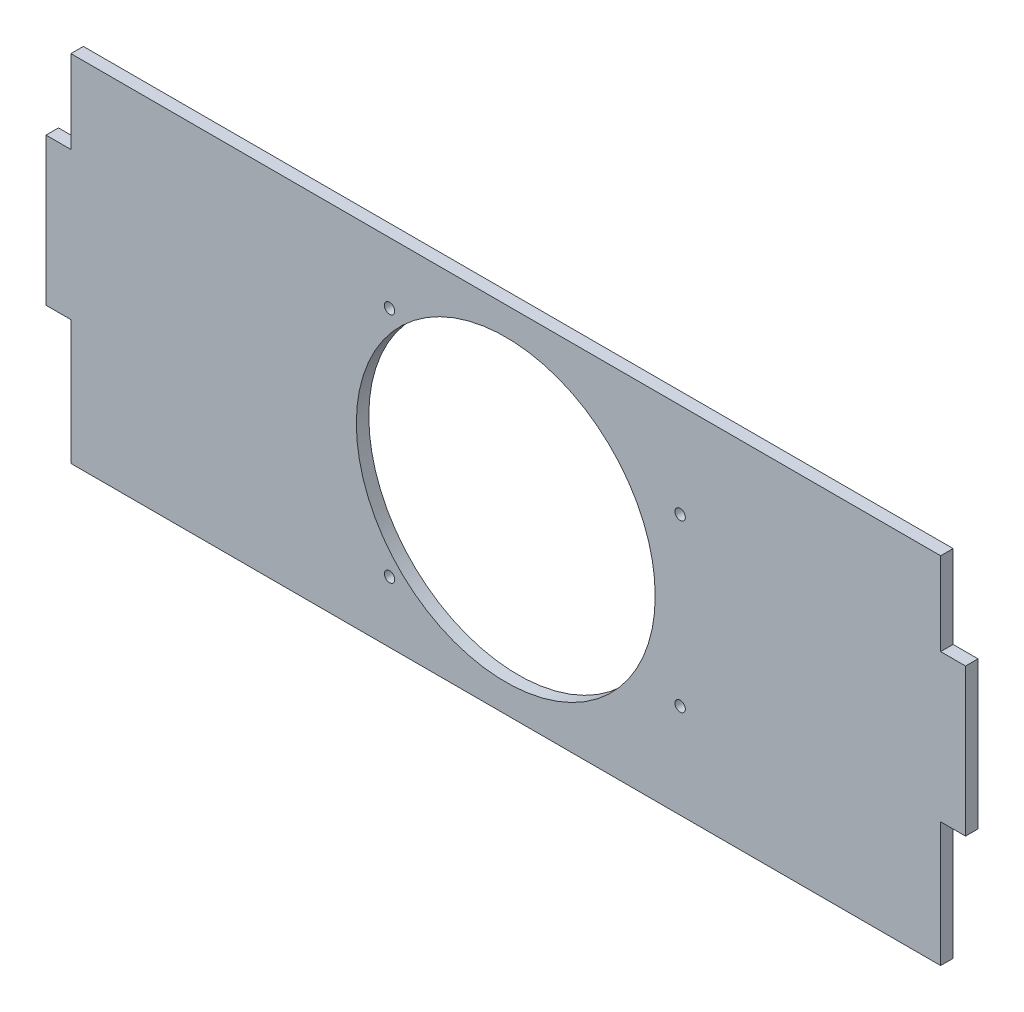
from build123d import *

# Parameters (mm, degrees)
BOSS_EXTRUDE1_DEPTH = 3
SKETCH2_R           = 36
CUT_EXTRUDE1_DEPTH  = 229.367029144
CAVITY1_OUTLINE_R   = 1.25
CAVITY1_DEPTH       = 3


# Read off the part's stored shape, not the designer's step: Cavity1
with BuildPart() as part:
    # Sketch1 → Boss-Extrude1 (new body)
    with BuildSketch(Plane.XY):
        Polygon((6, -30), (215.5, -30), (215.5, 0), (221.5, 0), (221.5, 35.5), (215.5, 35.5), (215.5, 55.5), (6, 55.5), (6, 35.5), (0, 35.5), (0, 0), (6, 0), align=None)
    extrude(amount=BOSS_EXTRUDE1_DEPTH)

    # Sketch2 → Cut-Extrude1 (cut, through all)
    with BuildSketch(Plane.XY.offset(3)):
        with Locations((110.75, 12.75)):
            Circle(SKETCH2_R)
    extrude(amount=-CUT_EXTRUDE1_DEPTH, mode=Mode.SUBTRACT)

    # Cavity1 outline → Cavity1 (cut)
    with BuildSketch(Plane.XY):
        with Locations((152.75, 32.75)):
            Circle(CAVITY1_OUTLINE_R)
        with Locations((152.75, -7.25)):
            Circle(CAVITY1_OUTLINE_R)
        with Locations((82.75, -15.25)):
            Circle(CAVITY1_OUTLINE_R)
        with Locations((82.75, 40.75)):
            Circle(CAVITY1_OUTLINE_R)
    extrude(amount=CAVITY1_DEPTH, mode=Mode.SUBTRACT)


solid = part.part
